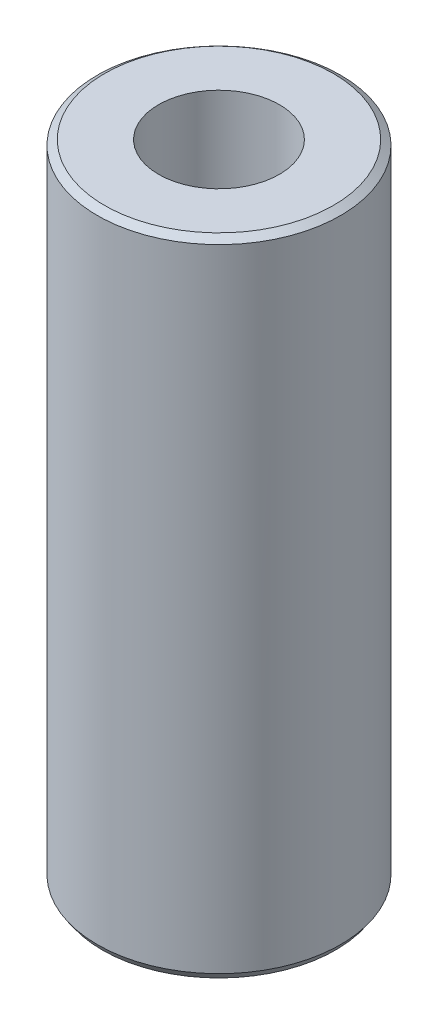
from build123d import *
from OCP.BRepFilletAPI import BRepFilletAPI_MakeChamfer

# Parameters (mm, degrees)
SKETCH1_R           = 5
BOSS_EXTRUDE1_DEPTH = 26.457808618
SKETCH2_R           = 2.483328494
CUT_EXTRUDE1_DEPTH  = 28.386413362
CHAMFER1_SIZE       = 0.207223995
CHAMFER1_SIZE2      = 0.29968346


with BuildPart() as part:
    # Sketch1 → Boss-Extrude1 (new body)
    with BuildSketch(Plane(origin=(0, 0, 0), x_dir=(1, 0, 0), z_dir=(0, 1, 0))):
        Circle(SKETCH1_R)
    extrude(amount=BOSS_EXTRUDE1_DEPTH)

    # Sketch2 → Cut-Extrude1 (cut, through all)
    with BuildSketch(Plane(origin=(0, 0, 0), x_dir=(1, 0, 0), z_dir=(0, 1, 0))):
        Circle(SKETCH2_R)
    extrude(amount=CUT_EXTRUDE1_DEPTH, mode=Mode.SUBTRACT)

    # Chamfer1: one chamfer whose edges measure the first distance from different faces: ONE call of the kernel's chamfer builder (chamfer() names one face for all edges)
    chamfer1_edges_1 = [part.edges().sort_by_distance(p)[0] for p in [
        (-5, 26.457808618, 0),
    ]]
    chamfer1_side_1 = [part.faces().sort_by_distance(p)[0] for p in [
        (-5, 13.228904309, 0),
    ]]
    chamfer1_edges_2 = [part.edges().sort_by_distance(p)[0] for p in [
        (-5, 0, 0),
    ]]
    chamfer1_side_2 = [part.faces().sort_by_distance(p)[0] for p in [
        (-4.858578644, 0, 0),
    ]]
    chamfer1 = BRepFilletAPI_MakeChamfer(part.part.solid().wrapped)
    for e in chamfer1_edges_1:
        chamfer1.Add(CHAMFER1_SIZE, CHAMFER1_SIZE2, e.wrapped, chamfer1_side_1[0].wrapped)  # the first distance lies on this face
    for e in chamfer1_edges_2:
        chamfer1.Add(CHAMFER1_SIZE, CHAMFER1_SIZE2, e.wrapped, chamfer1_side_2[0].wrapped)  # the first distance lies on this face
    add(Compound.cast(chamfer1.Shape()), mode=Mode.REPLACE)


solid = part.part
